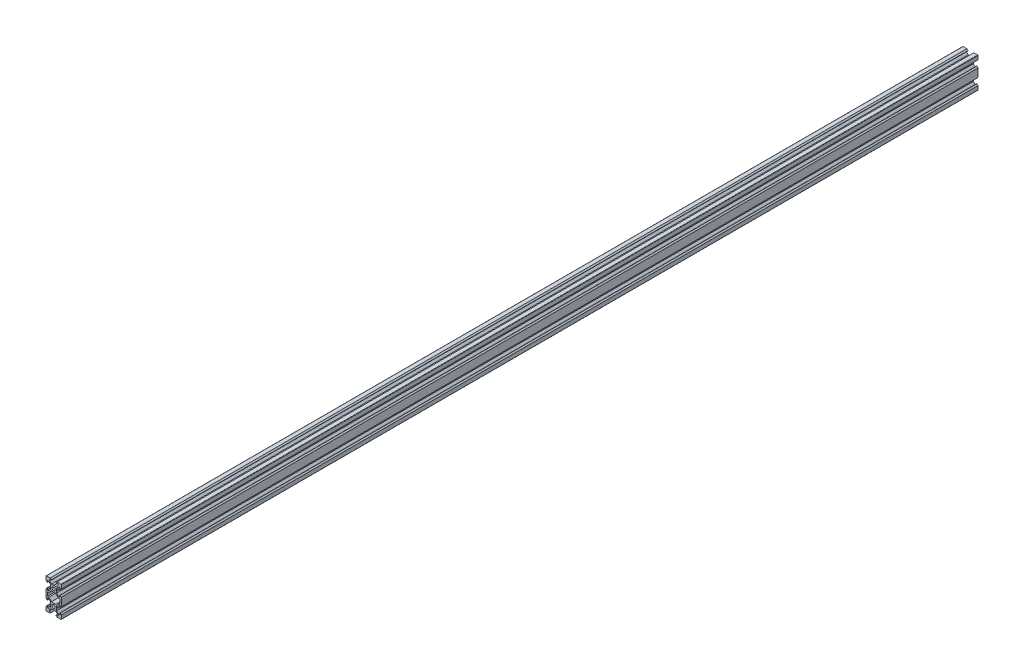
from build123d import *

# Parameters (mm, degrees)
V_SLOT_START                            = -40.720177315
V_SLOT_20X40X1000_LINEAR_RAIL_OUTLINE_R = 2.1
V_SLOT_20X40X1000_LINEAR_RAIL_DEPTH     = 1000
SKETCH1_R                               = 2.1
BOSS_EXTRUDE1_DEPTH                     = 200


# Read off the part's stored shape, not the designer's step: V-Slot 20x40x1000 Linear Rail
with BuildPart() as part:
    # V-Slot 20x40x1000 Linear Rail outline → V-Slot 20x40x1000 Linear Rail (new body)
    with BuildSketch(Plane.XY.offset(V_SLOT_START)):
        with BuildLine():
            Line((17.922647509, 56.20590772), (17.922647509, 58.835247549))
            Line((17.922647509, 58.835247549), (17.712647509, 59.045247549))
            Line((17.712647509, 59.045247549), (17.922647509, 59.255247549))
            Line((17.922647509, 59.255247549), (17.922647509, 61.884587377))
            Line((17.922647509, 61.884587377), (20.583307681, 64.545247549))
            Line((20.583307681, 64.545247549), (22.222647509, 64.545247549))
            Line((22.222647509, 64.545247549), (22.222647509, 62.170247549))
            Line((22.222647509, 62.170247549), (22.567647509, 62.170247549))
            Line((22.567647509, 62.170247549), (24.022647509, 63.625247549))
            Line((24.022647509, 63.625247549), (24.022647509, 68.545247549))
            ThreePointArc((24.022647509, 68.545247549), (23.876200899, 68.898800939), (23.522647509, 69.045247549))
            Line((23.522647509, 69.045247549), (18.602647509, 69.045247549))
            Line((18.602647509, 69.045247549), (17.147647509, 67.590247549))
            Line((17.147647509, 67.590247549), (17.147647509, 67.245247549))
            Line((17.147647509, 67.245247549), (19.522647509, 67.245247549))
            Line((19.522647509, 67.245247549), (19.522647509, 65.60590772))
            Line((19.522647509, 65.60590772), (16.861987337, 62.945247549))
            Line((16.861987337, 62.945247549), (14.232647509, 62.945247549))
            Line((14.232647509, 62.945247549), (14.022647509, 62.735247549))
            Line((14.022647509, 62.735247549), (13.812647509, 62.945247549))
            Line((13.812647509, 62.945247549), (11.183307681, 62.945247549))
            Line((11.183307681, 62.945247549), (8.522647509, 65.60590772))
            Line((8.522647509, 65.60590772), (8.522647509, 67.245247549))
            Line((8.522647509, 67.245247549), (10.897647509, 67.245247549))
            Line((10.897647509, 67.245247549), (10.897647509, 67.590247549))
            Line((10.897647509, 67.590247549), (9.442647509, 69.045247549))
            Line((9.442647509, 69.045247549), (4.522647509, 69.045247549))
            ThreePointArc((4.522647509, 69.045247549), (4.169094118, 68.898800939), (4.022647509, 68.545247549))
            Line((4.022647509, 68.545247549), (4.022647509, 63.625247549))
            Line((4.022647509, 63.625247549), (5.477647509, 62.170247549))
            Line((5.477647509, 62.170247549), (5.822647509, 62.170247549))
            Line((5.822647509, 62.170247549), (5.822647509, 64.545247549))
            Line((5.822647509, 64.545247549), (7.461987337, 64.545247549))
            Line((7.461987337, 64.545247549), (10.122647509, 61.884587377))
            Line((10.122647509, 61.884587377), (10.122647509, 59.255247549))
            Line((10.122647509, 59.255247549), (10.332647509, 59.045247549))
            Line((10.332647509, 59.045247549), (10.122647509, 58.835247549))
            Line((10.122647509, 58.835247549), (10.122647509, 56.20590772))
            Line((10.122647509, 56.20590772), (7.461987337, 53.545247549))
            Line((7.461987337, 53.545247549), (5.822647509, 53.545247549))
            Line((5.822647509, 53.545247549), (5.822647509, 55.920247549))
            Line((5.822647509, 55.920247549), (5.477647509, 55.920247549))
            Line((5.477647509, 55.920247549), (4.022647509, 54.465247549))
            Line((4.022647509, 54.465247549), (4.022647509, 43.625247549))
            Line((4.022647509, 43.625247549), (5.477647509, 42.170247549))
            Line((5.477647509, 42.170247549), (5.822647509, 42.170247549))
            Line((5.822647509, 42.170247549), (5.822647509, 44.545247549))
            Line((5.822647509, 44.545247549), (7.461987337, 44.545247549))
            Line((7.461987337, 44.545247549), (10.122647509, 41.884587377))
            Line((10.122647509, 41.884587377), (10.122647509, 39.255247549))
            Line((10.122647509, 39.255247549), (10.332647509, 39.045247549))
            Line((10.332647509, 39.045247549), (10.122647509, 38.835247549))
            Line((10.122647509, 38.835247549), (10.122647509, 36.20590772))
            Line((10.122647509, 36.20590772), (7.461987337, 33.545247549))
            Line((7.461987337, 33.545247549), (5.822647509, 33.545247549))
            Line((5.822647509, 33.545247549), (5.822647509, 35.920247549))
            Line((5.822647509, 35.920247549), (5.477647509, 35.920247549))
            Line((5.477647509, 35.920247549), (4.022647509, 34.465247549))
            Line((4.022647509, 34.465247549), (4.022647509, 29.545247549))
            ThreePointArc((4.022647509, 29.545247549), (4.169094118, 29.191694158), (4.522647509, 29.045247549))
            Line((4.522647509, 29.045247549), (9.442647509, 29.045247549))
            Line((9.442647509, 29.045247549), (10.897647509, 30.500247549))
            Line((10.897647509, 30.500247549), (10.897647509, 30.845247549))
            Line((10.897647509, 30.845247549), (8.522647509, 30.845247549))
            Line((8.522647509, 30.845247549), (8.522647509, 32.484587377))
            Line((8.522647509, 32.484587377), (11.183307681, 35.145247549))
            Line((11.183307681, 35.145247549), (13.812647509, 35.145247549))
            Line((13.812647509, 35.145247549), (14.022647509, 35.355247549))
            Line((14.022647509, 35.355247549), (14.232647509, 35.145247549))
            Line((14.232647509, 35.145247549), (16.861987337, 35.145247549))
            Line((16.861987337, 35.145247549), (19.522647509, 32.484587377))
            Line((19.522647509, 32.484587377), (19.522647509, 30.845247549))
            Line((19.522647509, 30.845247549), (17.147647509, 30.845247549))
            Line((17.147647509, 30.845247549), (17.147647509, 30.500247549))
            Line((17.147647509, 30.500247549), (18.602647509, 29.045247549))
            Line((18.602647509, 29.045247549), (23.522647509, 29.045247549))
            ThreePointArc((23.522647509, 29.045247549), (23.876200899, 29.191694158), (24.022647509, 29.545247549))
            Line((24.022647509, 29.545247549), (24.022647509, 34.465247549))
            Line((24.022647509, 34.465247549), (22.567647509, 35.920247549))
            Line((22.567647509, 35.920247549), (22.222647509, 35.920247549))
            Line((22.222647509, 35.920247549), (22.222647509, 33.545247549))
            Line((22.222647509, 33.545247549), (20.583307681, 33.545247549))
            Line((20.583307681, 33.545247549), (17.922647509, 36.20590772))
            Line((17.922647509, 36.20590772), (17.922647509, 38.835247549))
            Line((17.922647509, 38.835247549), (17.712647509, 39.045247549))
            Line((17.712647509, 39.045247549), (17.922647509, 39.255247549))
            Line((17.922647509, 39.255247549), (17.922647509, 41.884587377))
            Line((17.922647509, 41.884587377), (20.583307681, 44.545247549))
            Line((20.583307681, 44.545247549), (22.222647509, 44.545247549))
            Line((22.222647509, 44.545247549), (22.222647509, 42.170247549))
            Line((22.222647509, 42.170247549), (22.567647509, 42.170247549))
            Line((22.567647509, 42.170247549), (24.022647509, 43.625247549))
            Line((24.022647509, 43.625247549), (24.022647509, 54.465247549))
            Line((24.022647509, 54.465247549), (22.567647509, 55.920247549))
            Line((22.567647509, 55.920247549), (22.222647509, 55.920247549))
            Line((22.222647509, 55.920247549), (22.222647509, 53.545247549))
            Line((22.222647509, 53.545247549), (20.583307681, 53.545247549))
            Line((20.583307681, 53.545247549), (17.922647509, 56.20590772))
        make_face()
        with Locations((14.022647509, 39.045247549)):
            Circle(V_SLOT_20X40X1000_LINEAR_RAIL_OUTLINE_R, mode=Mode.SUBTRACT)
        Polygon((11.183307681, 42.945247549), (7.783307681, 46.345247549), (5.822647509, 46.345247549), (5.822647509, 51.745247549), (7.783307681, 51.745247549), (11.183307681, 55.145247549), (16.861987337, 55.145247549), (20.261987337, 51.745247549), (22.222647509, 51.745247549), (22.222647509, 46.345247549), (20.261987337, 46.345247549), (16.861987337, 42.945247549), align=None, mode=Mode.SUBTRACT)
        with Locations((14.022647509, 59.045247549)):
            Circle(V_SLOT_20X40X1000_LINEAR_RAIL_OUTLINE_R, mode=Mode.SUBTRACT)
    extrude(amount=V_SLOT_20X40X1000_LINEAR_RAIL_DEPTH)

    # Sketch1 → Boss-Extrude1 (add)
    with BuildSketch(Plane.XY.offset(959.279822685)):
        with BuildLine():
            Line((17.922647509, 58.835247549), (17.712647509, 59.045247549))
            Line((17.712647509, 59.045247549), (17.922647509, 59.255247549))
            Line((17.922647509, 59.255247549), (17.922647509, 61.884587377))
            Line((17.922647509, 61.884587377), (20.583307681, 64.545247549))
            Line((20.583307681, 64.545247549), (22.222647509, 64.545247549))
            Line((22.222647509, 64.545247549), (22.222647509, 62.170247549))
            Line((22.222647509, 62.170247549), (22.567647509, 62.170247549))
            Line((22.567647509, 62.170247549), (24.022647509, 63.625247549))
            Line((24.022647509, 63.625247549), (24.022647509, 68.545247549))
            ThreePointArc((24.022647509, 68.545247549), (23.876200899, 68.898800939), (23.522647509, 69.045247549))
            Line((23.522647509, 69.045247549), (18.602647509, 69.045247549))
            Line((18.602647509, 69.045247549), (17.147647509, 67.590247549))
            Line((17.147647509, 67.590247549), (17.147647509, 67.245247549))
            Line((17.147647509, 67.245247549), (19.522647509, 67.245247549))
            Line((19.522647509, 67.245247549), (19.522647509, 65.60590772))
            Line((19.522647509, 65.60590772), (16.861987337, 62.945247549))
            Line((16.861987337, 62.945247549), (14.232647509, 62.945247549))
            Line((14.232647509, 62.945247549), (14.022647509, 62.735247549))
            Line((14.022647509, 62.735247549), (13.812647509, 62.945247549))
            Line((13.812647509, 62.945247549), (11.183307681, 62.945247549))
            Line((11.183307681, 62.945247549), (8.522647509, 65.60590772))
            Line((8.522647509, 65.60590772), (8.522647509, 67.245247549))
            Line((8.522647509, 67.245247549), (10.897647509, 67.245247549))
            Line((10.897647509, 67.245247549), (10.897647509, 67.590247549))
            Line((10.897647509, 67.590247549), (9.442647509, 69.045247549))
            Line((9.442647509, 69.045247549), (4.522647509, 69.045247549))
            ThreePointArc((4.522647509, 69.045247549), (4.169094118, 68.898800939), (4.022647509, 68.545247549))
            Line((4.022647509, 68.545247549), (4.022647509, 63.625247549))
            Line((4.022647509, 63.625247549), (5.477647509, 62.170247549))
            Line((5.477647509, 62.170247549), (5.822647509, 62.170247549))
            Line((5.822647509, 62.170247549), (5.822647509, 64.545247549))
            Line((5.822647509, 64.545247549), (7.461987337, 64.545247549))
            Line((7.461987337, 64.545247549), (10.122647509, 61.884587377))
            Line((10.122647509, 61.884587377), (10.122647509, 59.255247549))
            Line((10.122647509, 59.255247549), (10.332647509, 59.045247549))
            Line((10.332647509, 59.045247549), (10.122647509, 58.835247549))
            Line((10.122647509, 58.835247549), (10.122647509, 56.20590772))
            Line((10.122647509, 56.20590772), (7.461987337, 53.545247549))
            Line((7.461987337, 53.545247549), (5.822647509, 53.545247549))
            Line((5.822647509, 53.545247549), (5.822647509, 55.920247549))
            Line((5.822647509, 55.920247549), (5.477647509, 55.920247549))
            Line((5.477647509, 55.920247549), (4.022647509, 54.465247549))
            Line((4.022647509, 54.465247549), (4.022647509, 43.625247549))
            Line((4.022647509, 43.625247549), (5.477647509, 42.170247549))
            Line((5.477647509, 42.170247549), (5.822647509, 42.170247549))
            Line((5.822647509, 42.170247549), (5.822647509, 44.545247549))
            Line((5.822647509, 44.545247549), (7.461987337, 44.545247549))
            Line((7.461987337, 44.545247549), (10.122647509, 41.884587377))
            Line((10.122647509, 41.884587377), (10.122647509, 39.255247549))
            Line((10.122647509, 39.255247549), (10.332647509, 39.045247549))
            Line((10.332647509, 39.045247549), (10.122647509, 38.835247549))
            Line((10.122647509, 38.835247549), (10.122647509, 36.20590772))
            Line((10.122647509, 36.20590772), (7.461987337, 33.545247549))
            Line((7.461987337, 33.545247549), (5.822647509, 33.545247549))
            Line((5.822647509, 33.545247549), (5.822647509, 35.920247549))
            Line((5.822647509, 35.920247549), (5.477647509, 35.920247549))
            Line((5.477647509, 35.920247549), (4.022647509, 34.465247549))
            Line((4.022647509, 34.465247549), (4.022647509, 29.545247549))
            ThreePointArc((4.022647509, 29.545247549), (4.169094118, 29.191694158), (4.522647509, 29.045247549))
            Line((4.522647509, 29.045247549), (9.442647509, 29.045247549))
            Line((9.442647509, 29.045247549), (10.897647509, 30.500247549))
            Line((10.897647509, 30.500247549), (10.897647509, 30.845247549))
            Line((10.897647509, 30.845247549), (8.522647509, 30.845247549))
            Line((8.522647509, 30.845247549), (8.522647509, 32.484587377))
            Line((8.522647509, 32.484587377), (11.183307681, 35.145247549))
            Line((11.183307681, 35.145247549), (13.812647509, 35.145247549))
            Line((13.812647509, 35.145247549), (14.022647509, 35.355247549))
            Line((14.022647509, 35.355247549), (14.232647509, 35.145247549))
            Line((14.232647509, 35.145247549), (16.861987337, 35.145247549))
            Line((16.861987337, 35.145247549), (19.522647509, 32.484587377))
            Line((19.522647509, 32.484587377), (19.522647509, 30.845247549))
            Line((19.522647509, 30.845247549), (17.147647509, 30.845247549))
            Line((17.147647509, 30.845247549), (17.147647509, 30.500247549))
            Line((17.147647509, 30.500247549), (18.602647509, 29.045247549))
            Line((18.602647509, 29.045247549), (23.522647509, 29.045247549))
            ThreePointArc((23.522647509, 29.045247549), (23.876200899, 29.191694158), (24.022647509, 29.545247549))
            Line((24.022647509, 29.545247549), (24.022647509, 34.465247549))
            Line((24.022647509, 34.465247549), (22.567647509, 35.920247549))
            Line((22.567647509, 35.920247549), (22.222647509, 35.920247549))
            Line((22.222647509, 35.920247549), (22.222647509, 33.545247549))
            Line((22.222647509, 33.545247549), (20.583307681, 33.545247549))
            Line((20.583307681, 33.545247549), (17.922647509, 36.20590772))
            Line((17.922647509, 36.20590772), (17.922647509, 38.835247549))
            Line((17.922647509, 38.835247549), (17.712647509, 39.045247549))
            Line((17.712647509, 39.045247549), (17.922647509, 39.255247549))
            Line((17.922647509, 39.255247549), (17.922647509, 41.884587377))
            Line((17.922647509, 41.884587377), (20.583307681, 44.545247549))
            Line((20.583307681, 44.545247549), (22.222647509, 44.545247549))
            Line((22.222647509, 44.545247549), (22.222647509, 42.170247549))
            Line((22.222647509, 42.170247549), (22.567647509, 42.170247549))
            Line((22.567647509, 42.170247549), (24.022647509, 43.625247549))
            Line((24.022647509, 43.625247549), (24.022647509, 54.465247549))
            Line((24.022647509, 54.465247549), (22.567647509, 55.920247549))
            Line((22.567647509, 55.920247549), (22.222647509, 55.920247549))
            Line((22.222647509, 55.920247549), (22.222647509, 53.545247549))
            Line((22.222647509, 53.545247549), (20.583307681, 53.545247549))
            Line((20.583307681, 53.545247549), (17.922647509, 56.20590772))
            Line((17.922647509, 56.20590772), (17.922647509, 58.835247549))
        make_face()
        with Locations((14.022647509, 39.045247549)):
            Circle(SKETCH1_R, mode=Mode.SUBTRACT)
        with Locations((14.022647509, 59.045247549)):
            Circle(SKETCH1_R, mode=Mode.SUBTRACT)
        Polygon((7.783307681, 51.745247549), (11.183307681, 55.145247549), (16.861987337, 55.145247549), (20.261987337, 51.745247549), (22.222647509, 51.745247549), (22.222647509, 46.345247549), (20.261987337, 46.345247549), (16.861987337, 42.945247549), (11.183307681, 42.945247549), (7.783307681, 46.345247549), (5.822647509, 46.345247549), (5.822647509, 51.745247549), align=None, mode=Mode.SUBTRACT)
    extrude(amount=BOSS_EXTRUDE1_DEPTH)


solid = part.part
